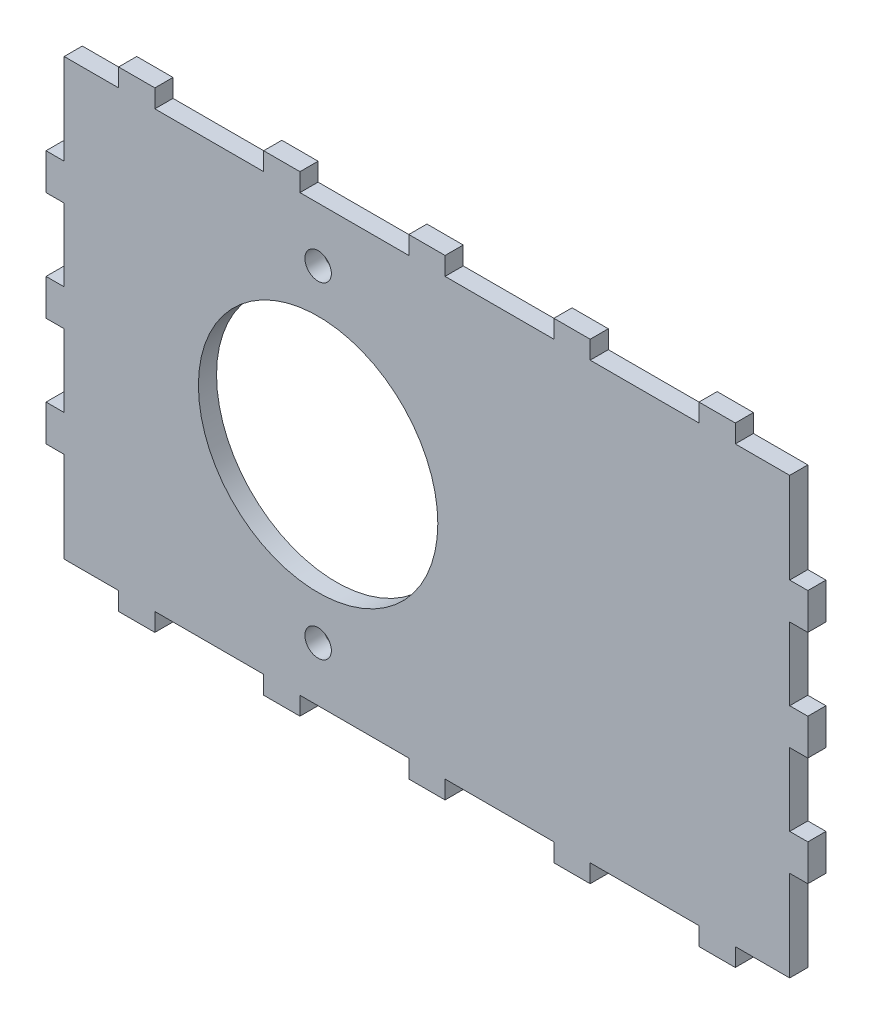
from build123d import *

# Parameters (mm, degrees)
SKETCH1_R           = 33
SKETCH1_R_2         = 3.65
BOSS_EXTRUDE1_DEPTH = 5


with BuildPart() as part:
    # Sketch1 → Boss-Extrude1 (new body)
    with BuildSketch(Plane.XY):
        Polygon((-85, 60), (-85, 65), (-75, 65), (-75, 60), (-45, 60), (-45, 65), (-35, 65), (-35, 60), (-5, 60), (-5, 65), (5, 65), (5, 60), (35, 60), (35, 65), (45, 65), (45, 60), (75, 60), (75, 65), (85, 65), (85, 60), (100, 60), (100, 35), (105, 35), (105, 25), (100, 25), (100, 5), (105, 5), (105, -5), (100, -5), (100, -25), (105, -25), (105, -35), (100, -35), (100, -60), (85, -60), (85, -65), (75, -65), (75, -60), (45, -60), (45, -65), (35, -65), (35, -60), (5, -60), (5, -65), (-5, -65), (-5, -60), (-35, -60), (-35, -65), (-45, -65), (-45, -60), (-75, -60), (-75, -65), (-85, -65), (-85, -60), (-100, -60), (-100, -35), (-105, -35), (-105, -25), (-100, -25), (-100, -5), (-105, -5), (-105, 5), (-100, 5), (-100, 25), (-105, 25), (-105, 35), (-100, 35), (-100, 60), align=None)
        with Locations((-30, 0)):
            Circle(SKETCH1_R, mode=Mode.SUBTRACT)
        with Locations((-30, -45)):
            Circle(SKETCH1_R_2, mode=Mode.SUBTRACT)
        with Locations((-30, 45)):
            Circle(SKETCH1_R_2, mode=Mode.SUBTRACT)
    extrude(amount=BOSS_EXTRUDE1_DEPTH)


solid = part.part
